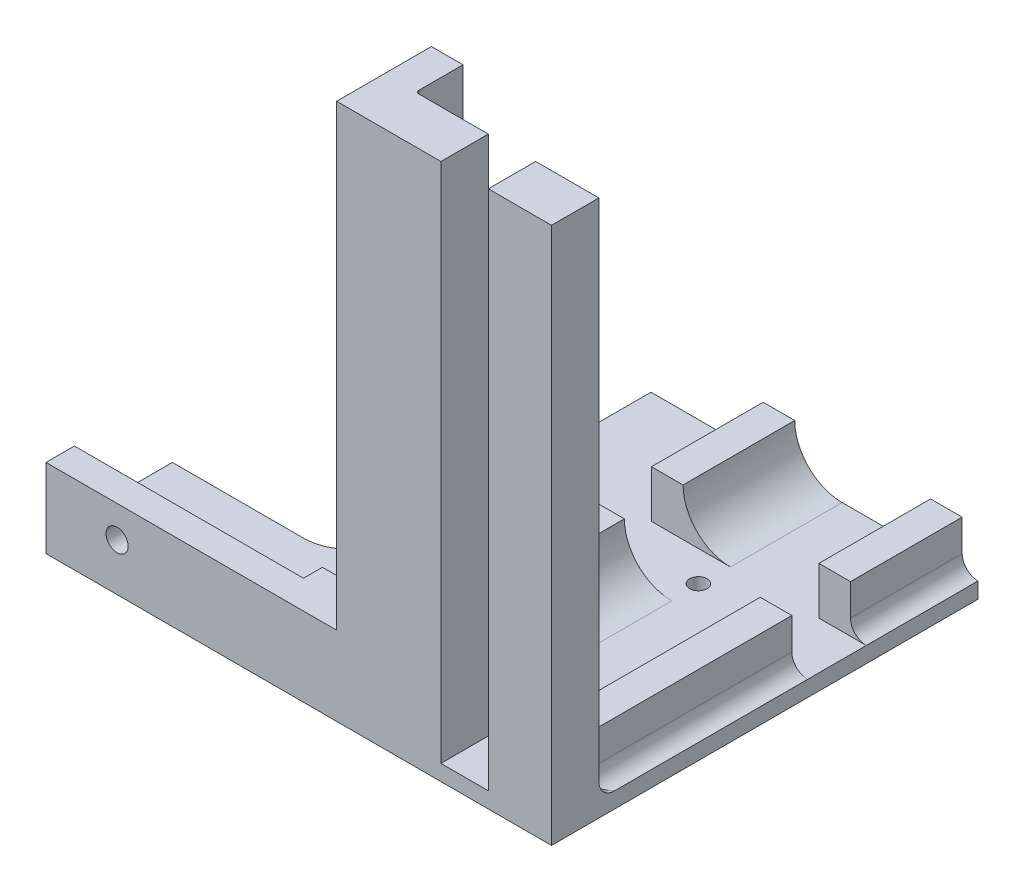
from build123d import *

# Parameters (mm, degrees)
BOSS_EXTRUDE1_DEPTH      = 250
BOSS_EXTRUDE2_DEPTH      = 50
BOSS_EXTRUDE2_2_DEPTH    = 50
LPATTERN1_COUNT          = 4
LPATTERN1_PITCH          = 60
SKETCH2_R                = 2.75
CUT_EXTRUDE1_DEPTH       = 251.864711302
UPPER_ACRYLIC_SUPP_W     = 20
UPPER_ACRYLIC_SUPP_H     = 250
BOSS_EXTRUDE3_DEPTH      = 5
UPPER_ACRYLIC_SUPP_3_W   = 10
UPPER_ACRYLIC_SUPP_3_H   = 66.073604859
UPPER_ACRYLIC_SUPP_3_H_2 = 41.475217291
UPPER_ACRYLIC_SUPP_3_H_3 = 42.557179481
UPPER_ACRYLIC_SUPP_3_H_4 = 45.558340935
BOSS_EXTRUDE4_DEPTH      = 15
FILLET1_R                = 15
SKETCH4_W                = 60
SKETCH4_H                = 15
BOSS_EXTRUDE5_DEPTH      = 5
SKETCH4_3_W              = 60
SKETCH4_3_H              = 15
BOSS_EXTRUDE6_DEPTH      = 60
SKETCH5_W                = 10
SKETCH5_H                = 45
BOSS_EXTRUDE7_DEPTH      = 15
BOSS_EXTRUDE8_START      = 250
SKETCH5_3_W              = 10
SKETCH5_3_H              = 45
BOSS_EXTRUDE8_DEPTH      = 15
FILLET2_R                = 1
SKETCH6_W                = 6
SKETCH6_H                = 60
CUT_EXTRUDE2_DEPTH       = 6
BOSS_EXTRUDE9_DEPTH      = 30
SKETCH8_W                = 333.602701612
SKETCH8_H                = 59.031331047
CUT_EXTRUDE3_DEPTH       = 150
SKETCH9_W                = 6
SKETCH9_H                = 20
CLOTH_ESCAPE_GAP_DEPTH   = 20
SKETCH11_W               = 9
SKETCH11_H               = 20
BOSS_EXTRUDE11_DEPTH     = 100
CUT_EXTRUDE4_DEPTH       = 68
SKETCH13_W               = 40
SKETCH13_H               = 5
BOSS_EXTRUDE13_DEPTH     = 100
CUT_EXTRUDE5_DEPTH       = 100
FILLET3_R                = 15
BOSS_EXTRUDE14_START     = -5
BOSS_EXTRUDE14_DEPTH     = 25
CUT_EXTRUDE6_DEPTH       = 30
CUT_EXTRUDE6_DEPTH_BACK  = 10
SKETCH16_5_W             = 8.5
SKETCH16_5_H             = 41.475217291
SKETCH16_5_H_2           = 42.557179481
SKETCH16_5_W_2           = 1.5
SKETCH16_5_H_3           = 42.177819043
SKETCH16_5_H_4           = 20.831100018
SKETCH16_5_H_5           = 17.311395043
SKETCH16_5_H_6           = 18.573684265
SKETCH16_5_H_7           = 65.073604859
SKETCH16_6_W             = 8.5
SKETCH16_6_H             = 41.475217291
SKETCH16_6_H_2           = 42.557179481
SKETCH16_6_W_2           = 1.5
SKETCH16_6_H_3           = 42.177819043
SKETCH16_6_H_4           = 20.831100018
SKETCH16_6_H_5           = 17.311395043
SKETCH16_6_H_6           = 18.573684265
SKETCH16_6_H_7           = 65.073604859
BOSS_EXTRUDE15_DEPTH     = 5
BOSS_EXTRUDE16_DEPTH     = 20
SKETCH16_8_W             = 8.5
SKETCH16_8_H             = 41.475217291
SKETCH16_8_H_2           = 42.557179481
SKETCH16_8_W_2           = 1.5
SKETCH16_8_H_3           = 42.177819043
SKETCH16_8_H_4           = 65.073604859
BOSS_EXTRUDE17_DEPTH     = 15
BOSS_EXTRUDE18_START     = -5
BOSS_EXTRUDE18_DEPTH     = 25
FILLET4_R                = 5
BOSS_EXTRUDE21_START     = 145
BOSS_EXTRUDE21_DEPTH     = 170
SKETCH19_R               = 3.5
CUT_EXTRUDE7_DEPTH       = 10
CUT_EXTRUDE8_DEPTH       = 355
CUT_EXTRUDE8_DEPTH_BACK  = 10
SKETCH20_R               = 3.5
SKETCH21_W               = 15
SKETCH21_H               = 197.501027769
CUT_EXTRUDE9_DEPTH       = 340
SKETCH22_W               = 160
SKETCH22_H               = 10
SKETCH22_H_2             = 135
CUT_EXTRUDE11_DEPTH      = 217


with BuildPart() as part:
    # profile → Boss-Extrude1 (new body)
    with BuildSketch(Plane.XY):
        Polygon((-14.746446609, 10.353553391), (-5.253553391, 10.353553391), (5.667330529, 10.353553391), (14.746446609, 10.353553391), (20, 10.353553391), (20, 15.353553391), (-20, 15.353553391), (-20, 10.353553391), align=None)
    extrude(amount=BOSS_EXTRUDE1_DEPTH)

    # Sketch2 → Cut-Extrude1 (cut, through all)
    with BuildSketch(Plane.XZ.offset(-10.353553391)):
        with Locations(Location((-10, 175, 0), (0, 0, 270))):
            Circle(SKETCH2_R)
        with Locations(Location((10, 175, 0), (0, 0, 270))):
            Circle(SKETCH2_R)
        with Locations(Location((-10, 115, 0), (0, 0, 270))):
            Circle(SKETCH2_R)
        with Locations(Location((10, 115, 0), (0, 0, 270))):
            Circle(SKETCH2_R)
        with Locations(Location((-10, 55, 0), (0, 0, 270))):
            Circle(SKETCH2_R)
        with Locations(Location((10, 55, 0), (0, 0, 270))):
            Circle(SKETCH2_R)
    extrude(amount=-CUT_EXTRUDE1_DEPTH, mode=Mode.SUBTRACT)

    # upper_acrylic_supp → Boss-Extrude3 (add)
    with BuildSketch(Plane(origin=(0, 15.353553391, 0), x_dir=(1, 0, 0), z_dir=(0, 1, 0))):
        with Locations((-30, -125)):
            Rectangle(UPPER_ACRYLIC_SUPP_W, UPPER_ACRYLIC_SUPP_H)
    extrude(amount=-BOSS_EXTRUDE3_DEPTH)

    # upper_acrylic_supp<3> → Boss-Extrude4 (add)
    with BuildSketch(Plane(origin=(0, 15.353553391, 0), x_dir=(1, 0, 0), z_dir=(0, 1, 0))):
        with Locations((-29.5, -216.963197571)):
            Rectangle(UPPER_ACRYLIC_SUPP_3_W, UPPER_ACRYLIC_SUPP_3_H)
        with Locations((-29.5, -144.615102231)):
            Rectangle(UPPER_ACRYLIC_SUPP_3_W, UPPER_ACRYLIC_SUPP_3_H_2)
        with Locations((-29.5, -85.287508801)):
            Rectangle(UPPER_ACRYLIC_SUPP_3_W, UPPER_ACRYLIC_SUPP_3_H_3)
        with Locations((-29.5, -22.779170468)):
            Rectangle(UPPER_ACRYLIC_SUPP_3_W, UPPER_ACRYLIC_SUPP_3_H_4)
    extrude(amount=BOSS_EXTRUDE4_DEPTH)

    # Fillet1
    fillet1_edges = [part.edges().sort_by_distance(p)[0] for p in [
        (-24.5, 15.353553391, 22.779170467),
        (-24.5, 15.353553391, 85.287508801),
        (-24.5, 15.353553391, 144.615102231),
        (-24.5, 15.353553391, 216.963197571),
    ]]
    fillet(fillet1_edges, radius=FILLET1_R - 0.0001)  # a hair under: the kernel refuses the full size



with BuildPart() as body_2:
    # Sketch1<3> → Boss-Extrude2 (new body)
    with BuildSketch(Plane.XY):
        Polygon((-7.253553391, 8.353553391), (-8.119669914, 7.487436867), (-5.5, 7.487436867), (-4.987436867, 7.487436867), (-5.5, 6.974873734), (-7.874873734, 4.6), (-12.125126266, 4.6), (-14.5, 6.974873734), (-15.012563133, 7.487436867), (-14.5, 7.487436867), (-11.880330086, 7.487436867), (-12.746446609, 8.353553391), (-14.746446609, 10.353553391), (-5.253553391, 10.353553391), align=None)
    boss_extrude2 = extrude(amount=BOSS_EXTRUDE2_DEPTH)


with BuildPart() as body_3:
    # Sketch1<3> → Boss-Extrude2 2 (new body)
    with BuildSketch(Plane.XY):
        Polygon((12.746446609, 8.353553391), (11.880330086, 7.487436867), (14.5, 7.487436867), (15.012563133, 7.487436867), (14.5, 6.974873734), (12.125126266, 4.6), (7.874873734, 4.6), (5.5, 6.974873734), (4.987436867, 7.487436867), (5.5, 7.487436867), (8.533447053, 7.487436867), (7.667330529, 8.353553391), (5.667330529, 10.353553391), (14.746446609, 10.353553391), align=None)
    boss_extrude2_2 = extrude(amount=BOSS_EXTRUDE2_2_DEPTH)


with BuildPart() as lpattern1_1:
    # LPattern1: pattern copy
    add(boss_extrude2.moved(Location(Vector(0, 0, 1) * (1 * LPATTERN1_PITCH))))


with BuildPart() as lpattern1_2:
    # LPattern1: pattern copy
    add(boss_extrude2.moved(Location(Vector(0, 0, 1) * (2 * LPATTERN1_PITCH))))


with BuildPart() as lpattern1_3:
    # LPattern1: pattern copy
    add(boss_extrude2.moved(Location(Vector(0, 0, 1) * (3 * LPATTERN1_PITCH))))


with BuildPart() as lpattern1_4:
    # LPattern1: pattern copy
    add(boss_extrude2_2.moved(Location(Vector(0, 0, 1) * (1 * LPATTERN1_PITCH))))


with BuildPart() as lpattern1_5:
    # LPattern1: pattern copy
    add(boss_extrude2_2.moved(Location(Vector(0, 0, 1) * (2 * LPATTERN1_PITCH))))


with BuildPart() as lpattern1_6:
    # LPattern1: pattern copy
    add(boss_extrude2_2.moved(Location(Vector(0, 0, 1) * (3 * LPATTERN1_PITCH))))


with BuildPart() as part_1:
    add(part.part)

    add(body_2.part)  # Boss-Extrude5 merges body 2

    add(body_3.part)  # Boss-Extrude5 merges body 3
    # Sketch4 → Boss-Extrude5 (add, symmetric)
    with BuildSketch(Plane(origin=(0, 15.353553391, 0), x_dir=(1, 0, 0), z_dir=(0, 1, 0))):
        with Locations((-10, -257.5)):
            Rectangle(SKETCH4_W, SKETCH4_H)
        with Locations((-10, 7.5)):
            Rectangle(SKETCH4_W, SKETCH4_H)
    extrude(amount=BOSS_EXTRUDE5_DEPTH, both=True)

    # Sketch4<3> → Boss-Extrude6 (add)
    with BuildSketch(Plane(origin=(0, 15.353553391, 0), x_dir=(1, 0, 0), z_dir=(0, 1, 0))):
        with Locations((-10, -257.5)):
            Rectangle(SKETCH4_3_W, SKETCH4_3_H)
        with Locations((-10, 7.5)):
            Rectangle(SKETCH4_3_W, SKETCH4_3_H)
    extrude(amount=BOSS_EXTRUDE6_DEPTH)

    # Sketch5 → Boss-Extrude7 (add)
    with BuildSketch(Plane(origin=(0, 0, 250), x_dir=(-1, 0, 0), z_dir=(0, 0, -1))):
        with Locations((29.5, 52.853553391)):
            Rectangle(SKETCH5_W, SKETCH5_H)
    extrude(amount=BOSS_EXTRUDE7_DEPTH)

    # Sketch5<3> → Boss-Extrude8 (add)
    with BuildSketch(Plane(origin=(0, 0, 250), x_dir=(-1, 0, 0), z_dir=(0, 0, -1)).offset(BOSS_EXTRUDE8_START)):
        with Locations((29.5, 52.853553391)):
            Rectangle(SKETCH5_3_W, SKETCH5_3_H)
    extrude(amount=-BOSS_EXTRUDE8_DEPTH)

    # Fillet2
    fillet2_edges = [part_1.edges().sort_by_distance(p)[0] for p in [
        (-24.5, 52.853503391, 250),
        (-24.5, 52.853503391, 0),
        (5.24995, 15.353553391, 250),
        (-20.106631007, 19.746922384, 250),
        (-20.106631007, 19.746922384, 0),
        (5.24995, 15.353553391, 0),
    ]]
    fillet(fillet2_edges, radius=FILLET2_R)

    # Sketch6 → Cut-Extrude2 (cut)
    with BuildSketch(Plane.ZY.offset(40)):
        with Locations((253, 45.353553391)):
            Rectangle(SKETCH6_W, SKETCH6_H)
        with Locations((-3, 45.353553391)):
            Rectangle(SKETCH6_W, SKETCH6_H)
    extrude(amount=-CUT_EXTRUDE2_DEPTH, mode=Mode.SUBTRACT)

    # Sketch7 → Boss-Extrude9 (add)
    with BuildSketch(Plane.ZY.offset(40)):
        Polygon((265, 75.353553391), (256, 75.353553391), (256, 15.353553391), (-6, 15.353553391), (-6, 75.353553391), (-15, 75.353553391), (-15, 10.353553391), (265, 10.353553391), align=None)
    extrude(amount=BOSS_EXTRUDE9_DEPTH)

    # Sketch8 → Cut-Extrude3 (cut)
    with BuildSketch(Plane.ZY.offset(70)):
        with Locations((122.426839416, 64.869218915)):
            Rectangle(SKETCH8_W, SKETCH8_H)
    extrude(amount=-CUT_EXTRUDE3_DEPTH, mode=Mode.SUBTRACT)

    # Sketch9 → cloth_escape_gap (add)
    with BuildSketch(Plane.ZY.offset(34)):
        with Locations((253, 25.353553391)):
            Rectangle(SKETCH9_W, SKETCH9_H)
        with Locations((-3, 25.353553391)):
            Rectangle(SKETCH9_W, SKETCH9_H)
    extrude(amount=CLOTH_ESCAPE_GAP_DEPTH)

    # Sketch11 → Boss-Extrude11 (add)
    with BuildSketch(Plane.ZY.offset(70)):
        with Locations((-10.5, 25.353553391)):
            Rectangle(SKETCH11_W, SKETCH11_H)
        with Locations((260.5, 25.353553391)):
            Rectangle(SKETCH11_W, SKETCH11_H)
    extrude(amount=BOSS_EXTRUDE11_DEPTH)

    # Sketch12 → Cut-Extrude4 (cut)
    with BuildSketch(Plane.XZ.offset(-10.353553391)):
        Polygon((-170, 265), (-70, 265), (-170, 260.5), align=None)
        Polygon((-70, -15), (-170, -10.5), (-170, -15), align=None)
    extrude(amount=-CUT_EXTRUDE4_DEPTH, mode=Mode.SUBTRACT)

    # Sketch13 → Boss-Extrude13 (add)
    with BuildSketch(Plane.ZY.offset(70)):
        with Locations((5, 12.853553391)):
            Rectangle(SKETCH13_W, SKETCH13_H)
        with Locations((245, 12.853553391)):
            Rectangle(SKETCH13_W, SKETCH13_H)
    extrude(amount=BOSS_EXTRUDE13_DEPTH)

    # Sketch14 → Cut-Extrude5 (cut)
    with BuildSketch(Plane(origin=(0, 15.353553391, 0), x_dir=(1, 0, 0), z_dir=(0, 1, 0))):
        Polygon((-70, -265), (-170, -260.5), (-170, -265), align=None)
        Polygon((-170, 15), (-170, 10.5), (-70, 15), align=None)
    extrude(amount=-CUT_EXTRUDE5_DEPTH, mode=Mode.SUBTRACT)

    # Fillet3
    fillet3_edges = [part_1.edges().sort_by_distance(p)[0] for p in [
        (-70, 12.853553391, 25),
        (-70, 12.853553391, 225),
    ]]
    fillet(fillet3_edges, radius=FILLET3_R)

    # Sketch16 → Boss-Extrude14 (add)
    with BuildSketch(Plane(origin=(0, 15.353553391, 0), x_dir=(1, 0, 0), z_dir=(0, 1, 0)).offset(BOSS_EXTRUDE14_START)):
        Polygon((28.5, 0), (33.5, 0), (33.5, 15), (18.5, 15), (18.5, 0), align=None)
        Polygon((18.5, -250), (18.5, -265), (33.5, -265), (33.5, -250), (28.5, -250), align=None)
    extrude(amount=BOSS_EXTRUDE14_DEPTH)

    # Sketch16<5> → Cut-Extrude6 (cut, two sides: drawn at the far end of the back side and taken through both)
    with BuildSketch(Plane(origin=(0, 15.353553391, 0), x_dir=(1, 0, 0), z_dir=(0, 1, 0)).offset(-CUT_EXTRUDE6_DEPTH_BACK)):
        Polygon((18.5, -250), (18.5, -265), (33.5, -265), (33.5, -250), (28.5, -250), align=None)
        Polygon((28.5, -250), (33.5, -250), (33.5, 0), (28.5, 0), (28.5, -43.177819043), (20, -43.177819043), (20, -64.008919061), (28.5, -64.008919061), (28.5, -106.566098542), (20, -106.566098542), (20, -123.877493585), (28.5, -123.877493585), (28.5, -165.352710876), (20, -165.352710876), (20, -183.926395141), (28.5, -183.926395141), align=None)
        with Locations((24.25, -144.615102231)):
            Rectangle(SKETCH16_5_W, SKETCH16_5_H)
        with Locations((24.25, -85.287508801)):
            Rectangle(SKETCH16_5_W, SKETCH16_5_H_2)
        Polygon((28.5, -43.177819043), (28.5, 0), (18.5, 0), (18.5, -1), (20, -1), (20, -43.177819043), align=None)
        Polygon((28.5, 0), (33.5, 0), (33.5, 15), (18.5, 15), (18.5, 0), align=None)
        with Locations((19.25, -22.088909521)):
            Rectangle(SKETCH16_5_W_2, SKETCH16_5_H_3)
        with Locations((19.25, -53.593369052)):
            Rectangle(SKETCH16_5_W_2, SKETCH16_5_H_4)
        with Locations((19.25, -85.287508801)):
            Rectangle(SKETCH16_5_W_2, SKETCH16_5_H_2)
        with Locations((19.25, -115.221796064)):
            Rectangle(SKETCH16_5_W_2, SKETCH16_5_H_5)
        with Locations((19.25, -144.615102231)):
            Rectangle(SKETCH16_5_W_2, SKETCH16_5_H)
        with Locations((19.25, -174.639553009)):
            Rectangle(SKETCH16_5_W_2, SKETCH16_5_H_6)
        with Locations((19.25, -216.463197571)):
            Rectangle(SKETCH16_5_W_2, SKETCH16_5_H_7)
        Polygon((18.5, -249), (18.5, -250), (28.5, -250), (28.5, -183.926395141), (20, -183.926395141), (20, -249), align=None)
    extrude(amount=CUT_EXTRUDE6_DEPTH + CUT_EXTRUDE6_DEPTH_BACK, mode=Mode.SUBTRACT)

    # Sketch16<6> → Boss-Extrude15 (add)
    with BuildSketch(Plane(origin=(0, 15.353553391, 0), x_dir=(1, 0, 0), z_dir=(0, 1, 0))):
        Polygon((28.5, -250), (33.5, -250), (33.5, 0), (28.5, 0), (28.5, -43.177819043), (20, -43.177819043), (20, -64.008919061), (28.5, -64.008919061), (28.5, -106.566098542), (20, -106.566098542), (20, -123.877493585), (28.5, -123.877493585), (28.5, -165.352710876), (20, -165.352710876), (20, -183.926395141), (28.5, -183.926395141), align=None)
        Polygon((18.5, -249), (18.5, -250), (28.5, -250), (28.5, -183.926395141), (20, -183.926395141), (20, -249), align=None)
        Polygon((18.5, -250), (18.5, -265), (33.5, -265), (33.5, -250), (28.5, -250), align=None)
        with Locations((24.25, -144.615102231)):
            Rectangle(SKETCH16_6_W, SKETCH16_6_H)
        with Locations((24.25, -85.287508801)):
            Rectangle(SKETCH16_6_W, SKETCH16_6_H_2)
        Polygon((28.5, -43.177819043), (28.5, 0), (18.5, 0), (18.5, -1), (20, -1), (20, -43.177819043), align=None)
        Polygon((28.5, 0), (33.5, 0), (33.5, 15), (18.5, 15), (18.5, 0), align=None)
        with Locations((19.25, -22.088909521)):
            Rectangle(SKETCH16_6_W_2, SKETCH16_6_H_3)
        with Locations((19.25, -53.593369052)):
            Rectangle(SKETCH16_6_W_2, SKETCH16_6_H_4)
        with Locations((19.25, -85.287508801)):
            Rectangle(SKETCH16_6_W_2, SKETCH16_6_H_2)
        with Locations((19.25, -115.221796064)):
            Rectangle(SKETCH16_6_W_2, SKETCH16_6_H_5)
        with Locations((19.25, -144.615102231)):
            Rectangle(SKETCH16_6_W_2, SKETCH16_6_H)
        with Locations((19.25, -174.639553009)):
            Rectangle(SKETCH16_6_W_2, SKETCH16_6_H_6)
        with Locations((19.25, -216.463197571)):
            Rectangle(SKETCH16_6_W_2, SKETCH16_6_H_7)
    extrude(amount=-BOSS_EXTRUDE15_DEPTH)

    # Sketch16<7> → Boss-Extrude16 (add)
    with BuildSketch(Plane(origin=(0, 15.353553391, 0), x_dir=(1, 0, 0), z_dir=(0, 1, 0))):
        Polygon((18.5, -250), (18.5, -265), (33.5, -265), (33.5, -250), (28.5, -250), align=None)
        Polygon((28.5, 0), (33.5, 0), (33.5, 15), (18.5, 15), (18.5, 0), align=None)
    extrude(amount=BOSS_EXTRUDE16_DEPTH)

    # Sketch16<8> → Boss-Extrude17 (add)
    with BuildSketch(Plane(origin=(0, 15.353553391, 0), x_dir=(1, 0, 0), z_dir=(0, 1, 0))):
        Polygon((18.5, -249), (18.5, -250), (28.5, -250), (28.5, -183.926395141), (20, -183.926395141), (20, -249), align=None)
        with Locations((24.25, -144.615102231)):
            Rectangle(SKETCH16_8_W, SKETCH16_8_H)
        with Locations((24.25, -85.287508801)):
            Rectangle(SKETCH16_8_W, SKETCH16_8_H_2)
        Polygon((28.5, -43.177819043), (28.5, 0), (18.5, 0), (18.5, -1), (20, -1), (20, -43.177819043), align=None)
        with Locations((19.25, -22.088909521)):
            Rectangle(SKETCH16_8_W_2, SKETCH16_8_H_3)
        with Locations((19.25, -85.287508801)):
            Rectangle(SKETCH16_8_W_2, SKETCH16_8_H_2)
        with Locations((19.25, -144.615102231)):
            Rectangle(SKETCH16_8_W_2, SKETCH16_8_H)
        with Locations((19.25, -216.463197571)):
            Rectangle(SKETCH16_8_W_2, SKETCH16_8_H_4)
    extrude(amount=BOSS_EXTRUDE17_DEPTH)

    # Sketch14<2> → Boss-Extrude18 (add)
    with BuildSketch(Plane(origin=(0, 15.353553391, 0), x_dir=(1, 0, 0), z_dir=(0, 1, 0)).offset(BOSS_EXTRUDE18_START)):
        Polygon((-70, -265), (-170, -260.5), (-170, -265), align=None)
        Polygon((-170, 15), (-170, 10.5), (-70, 15), align=None)
    extrude(amount=BOSS_EXTRUDE18_DEPTH)

    # Fillet4
    fillet4_edges = [part_1.edges().sort_by_distance(p)[0] for p in [
        (31, 15.353553391, 0),
        (28.5, 15.353553391, 21.588909521),
        (28.5, 15.353553391, 85.287508801),
        (28.5, 15.353553391, 144.615102231),
        (31, 15.353553391, 250),
        (28.5, 15.353553391, 216.963197571),
    ]]
    fillet(fillet4_edges, radius=FILLET4_R - 0.0001)  # a hair under: the kernel refuses the full size

    # Sketch18 → Boss-Extrude21 (add)
    with BuildSketch(Plane(origin=(0, 35.353553391, 0), x_dir=(1, 0, 0), z_dir=(0, 1, 0)).offset(BOSS_EXTRUDE21_START)):
        with BuildLine():
            Line((-34.5, -250), (-34.5, -265))
            Line((-34.5, -265), (33.5, -265))
            Line((33.5, -265), (33.5, -250))
            Line((33.5, -250), (-23.5, -250))
            ThreePointArc((-23.5, -250), (-24.207106781, -249.707106781), (-24.5, -249))
            Line((-24.5, -249), (-24.5, -235))
            Line((-24.5, -235), (-34.5, -235))
            Line((-34.5, -235), (-34.5, -250))
        make_face()
        with BuildLine():
            Line((-34.5, 15), (-34.5, 0))
            Line((-34.5, 0), (-34.5, -15))
            Line((-34.5, -15), (-24.5, -15))
            Line((-24.5, -15), (-24.5, -1))
            ThreePointArc((-24.5, -1), (-24.207106781, -0.292893219), (-23.5, 0))
            Line((-23.5, 0), (33.5, 0))
            Line((33.5, 0), (33.5, 15))
            Line((33.5, 15), (-34.5, 15))
        make_face()
    extrude(amount=-BOSS_EXTRUDE21_DEPTH)

    # Sketch19 → Cut-Extrude7 (cut)
    with BuildSketch(Plane(origin=(0, 15.353553391, 0), x_dir=(1, 0, 0), z_dir=(0, 1, 0))):
        with Locations(Location((-154, -9.5, 0), (0, 0, 270))):
            Circle(SKETCH19_R)
        with Locations(Location((-104, -9.5, 0), (0, 0, 270))):
            Circle(SKETCH19_R)
        with Locations(Location((-104, -240.5, 0), (0, 0, 270))):
            Circle(SKETCH19_R)
        with Locations(Location((-154, -240.5, 0), (0, 0, 270))):
            Circle(SKETCH19_R)
    extrude(amount=-CUT_EXTRUDE7_DEPTH, mode=Mode.SUBTRACT)

    # Sketch20 → Cut-Extrude8 (cut, two sides: drawn at the far end of the back side and taken through both)
    with BuildSketch(Plane(origin=(0, 0, 256), x_dir=(-1, 0, 0), z_dir=(0, 0, -1)).offset(-CUT_EXTRUDE8_DEPTH_BACK)):
        with Locations(Location((104, 25.353553391, 0), (0, 0, 180))):
            Circle(SKETCH20_R)
        with Locations(Location((154, 25.353553391, 0), (0, 0, 180))):
            Circle(SKETCH20_R)
    extrude(amount=CUT_EXTRUDE8_DEPTH + CUT_EXTRUDE8_DEPTH_BACK, mode=Mode.SUBTRACT)

    # Sketch21 → Cut-Extrude9 (cut)
    with BuildSketch(Plane.XY):
        with Locations((6, 114.104067276)):
            Rectangle(SKETCH21_W, SKETCH21_H)
    extrude(amount=CUT_EXTRUDE9_DEPTH, mode=Mode.SUBTRACT)


with BuildPart() as cut_extrude11_tool:
    # Sketch22 → Cut-Extrude11 (new body)
    with BuildSketch(Plane(origin=(0, 0, 0), x_dir=(1, 0, 0), z_dir=(0, 1, 0))):
        Polygon((-126.5, 15), (-186.5, 15), (-186.5, -265), (-126.5, -265), (-126.5, -130), (-126.5, -120), align=None)
        with Locations((-46.5, -125)):
            Rectangle(SKETCH22_W, SKETCH22_H)
        with Locations((-46.5, -52.5)):
            Rectangle(SKETCH22_W, SKETCH22_H_2)
    extrude(amount=CUT_EXTRUDE11_DEPTH)


with BuildPart() as part_2:
    add(part_1.part)

    # Cut-Extrude11: cut by cut_extrude11_tool
    add(cut_extrude11_tool.part, mode=Mode.SUBTRACT)


with BuildPart() as lpattern1_1_1:
    add(lpattern1_1.part)

    # Cut-Extrude11: cut by cut_extrude11_tool
    add(cut_extrude11_tool.part, mode=Mode.SUBTRACT)


with BuildPart() as lpattern1_2_1:
    add(lpattern1_2.part)

    # Cut-Extrude11: cut by cut_extrude11_tool
    add(cut_extrude11_tool.part, mode=Mode.SUBTRACT)


with BuildPart() as lpattern1_4_1:
    add(lpattern1_4.part)

    # Cut-Extrude11: cut by cut_extrude11_tool
    add(cut_extrude11_tool.part, mode=Mode.SUBTRACT)


with BuildPart() as lpattern1_5_1:
    add(lpattern1_5.part)

    # Cut-Extrude11: cut by cut_extrude11_tool
    add(cut_extrude11_tool.part, mode=Mode.SUBTRACT)


solid = Compound([lpattern1_3.part, lpattern1_6.part, part_2.part, lpattern1_2_1.part, lpattern1_5_1.part])
